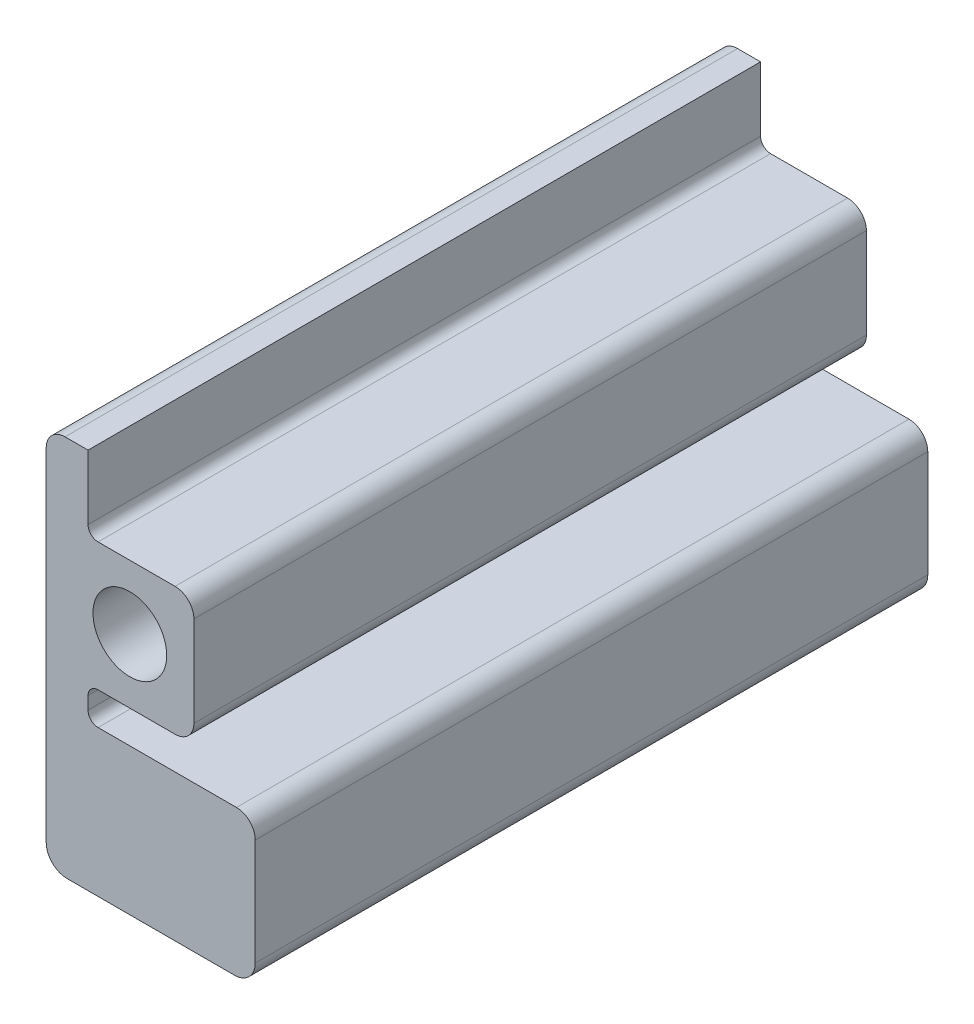
from build123d import *

# Parameters (mm, degrees)
SKETCH1_R           = 11.2
BOSS_EXTRUDE1_DEPTH = 204.313708212
CUT_EXTRUDE1_DEPTH  = 236.982


with BuildPart() as part:
    # Sketch1 → Boss-Extrude1 (new body)
    with BuildSketch(Plane.XY):
        with BuildLine():
            Line((-25.4, -67.479999962), (-25.4, 36.365))
            ThreePointArc((-25.4, 36.365), (-23.726115254, 40.406115254), (-19.685, 42.08))
            Line((-19.685, 42.08), (32.385, 42.08))
            ThreePointArc((32.385, 42.08), (36.426115254, 40.406115254), (38.1, 36.365))
            Line((38.1, 36.365), (38.1, 35.095))
            ThreePointArc((38.1, 35.095), (36.426115254, 31.053884746), (32.385, 29.38))
            Line((32.385, 29.38), (-9.652, 29.38))
            ThreePointArc((-9.652, 29.38), (-11.807261469, 28.487261469), (-12.7, 26.332))
            Line((-12.7, 26.332), (-12.7, 22.503))
            ThreePointArc((-12.7, 22.503), (-11.807261469, 20.347738531), (-9.652, 19.455))
            Line((-9.652, 19.455), (0, 19.455))
            Line((0, 19.455), (13.74, 19.455))
            ThreePointArc((13.74, 19.455), (17.781115254, 17.781115254), (19.455, 13.74))
            Line((19.455, 13.74), (19.455, 0))
            Line((19.455, 0), (19.455, -13.74))
            ThreePointArc((19.455, -13.74), (17.781115254, -17.781115254), (13.74, -19.455))
            Line((13.74, -19.455), (0, -19.455))
            Line((0, -19.455), (-9.652, -19.455))
            ThreePointArc((-9.652, -19.455), (-11.807261469, -20.347738531), (-12.7, -22.503))
            Line((-12.7, -22.503), (-12.7, -26.331999962))
            ThreePointArc((-12.7, -26.331999962), (-11.807261469, -28.487261431), (-9.652, -29.379999962))
            Line((-9.652, -29.379999962), (32.385, -29.379999962))
            ThreePointArc((32.385, -29.379999962), (36.426115254, -31.053884708), (38.1, -35.094999962))
            Line((38.1, -35.094999962), (38.1, -67.479999962))
            ThreePointArc((38.1, -67.479999962), (36.240128061, -71.970128023), (31.75, -73.829999962))
            Line((31.75, -73.829999962), (-19.05, -73.829999962))
            ThreePointArc((-19.05, -73.829999962), (-23.540128061, -71.970128023), (-25.4, -67.479999962))
        make_face()
        Circle(SKETCH1_R, mode=Mode.SUBTRACT)
    extrude(amount=BOSS_EXTRUDE1_DEPTH)

    # Sketch2 → Cut-Extrude1 (cut)
    with BuildSketch(Plane.XY.offset(204.313708212)):
        Polygon((19.455, -13.74), (38.1, -13.74), (38.1, 42.08), (-12.7, 42.08), (-12.7, 22.503), (19.455, 22.503), align=None)
    extrude(amount=-CUT_EXTRUDE1_DEPTH, mode=Mode.SUBTRACT)


solid = part.part
